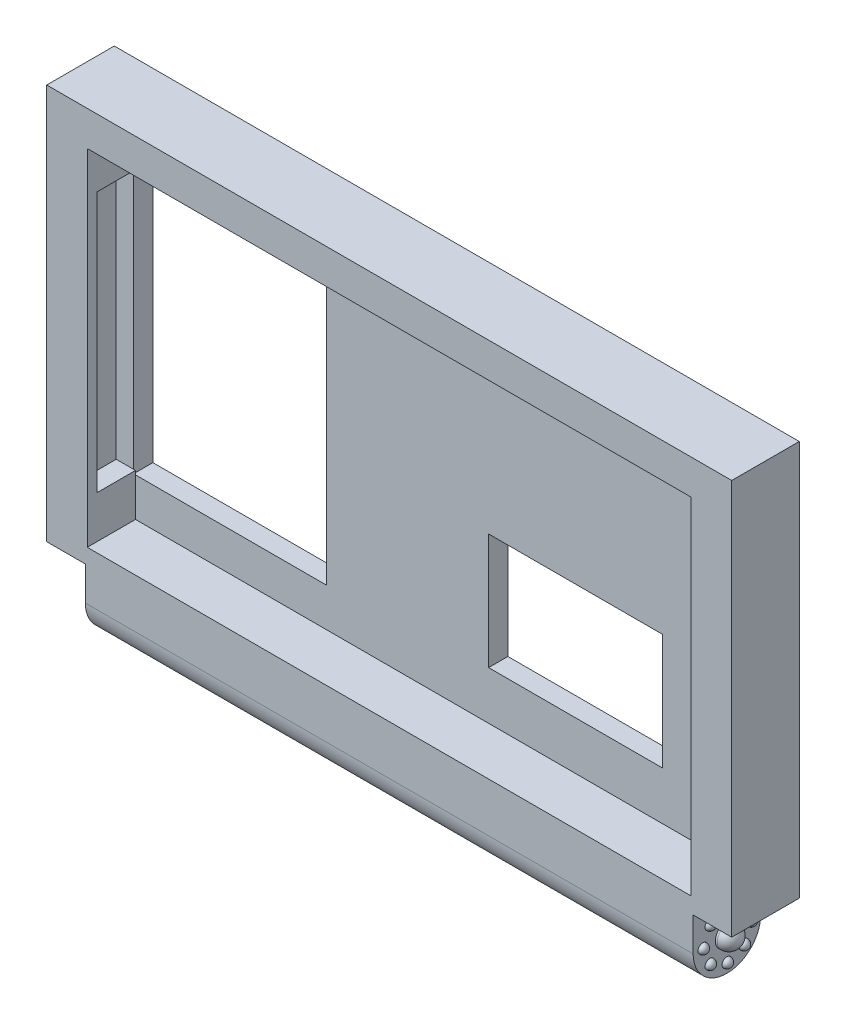
from build123d import *
from build123d.topology import SkipClean

# Parameters (mm, degrees)
SKETCH_1_W               = 35.5
SKETCH_1_H               = 24
EXTRUDE_1_DEPTH          = 3.5
SKETCH_2_W               = 31.3
SKETCH_2_H               = 17.9
CUT_EXTRUDE_1_DEPTH      = 2.5
SKETCH_12_W              = 3.5
SKETCH_12_H              = 3.5
CUT_EXTRUDE_9_DEPTH      = 2
SKETCH_13_W              = 3.5
SKETCH_13_H              = 3.5
CUT_EXTRUDE_10_DEPTH     = 2
SKETCH_14_W              = 10
SKETCH_14_H              = 13.9
CUT_EXTRUDE_11_DEPTH     = 2
SKETCH_18_W              = 2
SKETCH_18_H              = 13.5
CUT_EXTRUDE_12_DEPTH     = 1
SKETCH_19_W              = 9
SKETCH_19_H              = 6
CUT_EXTRUDE_13_DEPTH     = 2
SKETCH_20_R              = 0.6
EXTRUDE_3_DEPTH          = 0.1
EXTRUDE_START            = 0.1
SKETCH_21_R              = 0.6
EXTRUDE_4_DEPTH          = 0.1
FILLET_1_R               = 1.75
FILLET_2_R               = 1.75
PATTERN_CIRCULAR_2_COUNT = 8


with BuildPart() as part:
    # 草图1 → 凸台-拉伸1 (new body)
    with BuildSketch(Plane.XY):
        Rectangle(SKETCH_1_W, SKETCH_1_H)
    extrude(amount=EXTRUDE_1_DEPTH)

    # 草图2 → 切除-拉伸1 (cut)
    with BuildSketch(Plane.XY.offset(3.5)):
        with Locations((0, 1.25)):
            Rectangle(SKETCH_2_W, SKETCH_2_H)
    extrude(amount=-CUT_EXTRUDE_1_DEPTH, mode=Mode.SUBTRACT)

    # 草图12 → 切除-拉伸9 (cut)
    with BuildSketch(Plane.ZY.offset(17.75)):
        with Locations((1.75, -10.25)):
            Rectangle(SKETCH_12_W, SKETCH_12_H)
    extrude(amount=-CUT_EXTRUDE_9_DEPTH, mode=Mode.SUBTRACT)

    # 草图13 → 切除-拉伸10 (cut)
    with BuildSketch(Plane(origin=(17.75, 0, 0), x_dir=(0, 0, -1), z_dir=(1, 0, 0))):
        with Locations((-1.75, -10.25)):
            Rectangle(SKETCH_13_W, SKETCH_13_H)
    extrude(amount=-CUT_EXTRUDE_10_DEPTH, mode=Mode.SUBTRACT)

    # 草图14 → 切除-拉伸11 (cut)
    with BuildSketch(Plane.XY.offset(1)):
        with Locations((-10.75, 1.25)):
            Rectangle(SKETCH_14_W, SKETCH_14_H)
    extrude(amount=-CUT_EXTRUDE_11_DEPTH, mode=Mode.SUBTRACT)

    # 草图18 → 切除-拉伸12 (cut)
    with BuildSketch(Plane(origin=(-15.65, 0, 0), x_dir=(0, 0, -1), z_dir=(1, 0, 0))):
        with Locations((-2, 1.25)):
            Rectangle(SKETCH_18_W, SKETCH_18_H)
    extrude(amount=-CUT_EXTRUDE_12_DEPTH, mode=Mode.SUBTRACT)

    # 草图19 → 切除-拉伸13 (cut)
    with BuildSketch(Plane.XY.offset(1)):
        with Locations((7.15, -2.2)):
            Rectangle(SKETCH_19_W, SKETCH_19_H)
    extrude(amount=-CUT_EXTRUDE_13_DEPTH, mode=Mode.SUBTRACT)

    # 草图20 → 凸台-拉伸3 (add)
    with BuildSketch(Plane.ZY.offset(15.75)):
        with Locations(Location((1.75, -10.25, 0), (0, 0, 180))):
            Circle(SKETCH_20_R)
    extrude(amount=EXTRUDE_3_DEPTH)

    # 草图21 → 凸台-拉伸4 (add)
    with BuildSketch(Plane(origin=(15.75, 0, 0), x_dir=(0, 0, -1), z_dir=(1, 0, 0)).offset(EXTRUDE_START)):
        with Locations((-1.75, -10.25)):
            Circle(SKETCH_21_R)
    extrude(amount=-EXTRUDE_4_DEPTH)

    # 草图23 → 旋转1 (revolve)
    with BuildSketch(Plane.ZY.offset(15.85)):
        with BuildLine():
            Line((1.75, -9.65), (1.75, -10.85))
            ThreePointArc((1.75, -10.85), (2.35, -10.25), (1.75, -9.65))
        make_face()
    revolve(axis=Axis((-15.85, -9.65, 1.75), (0, -1, 0)))

    # 草图24 → 旋转2 (revolve)
    with SkipClean():  # the faces are left unmerged after this step: merging them gives an invalid solid
        with BuildSketch(Plane(origin=(15.85, 0, 0), x_dir=(0, 0, -1), z_dir=(1, 0, 0))):
            with BuildLine():
                ThreePointArc((-2.140499307, -9.794467025), (-2.205532975, -10.640499307), (-1.359500693, -10.705532975))
                Line((-1.359500693, -10.705532975), (-2.140499307, -9.794467025))
            make_face()
            with BuildLine():
                Line((-2.140499307, -9.794467025), (-1.359500693, -10.705532975))
                ThreePointArc((-1.359500693, -10.705532975), (-1.204885524, -10.500699438), (-1.15, -10.25))
                ThreePointArc((-1.15, -10.25), (-1.499300562, -9.704885524), (-2.140499307, -9.794467025))
            make_face()
        revolve(axis=Axis((15.85, -10.705532975, 1.359500693), (0, 0.7592216255630779, 0.65083217750612)))
    add(part.part.scale(1), mode=Mode.REPLACE)  # the faces are merged on a copy

    # 圆角1
    fillet_1_edges = [part.edges().sort_by_distance(p)[0] for p in [
        (0, -12, 3.5),
    ]]
    fillet(fillet_1_edges, radius=FILLET_1_R)

    # 圆角2
    fillet_2_edges = [part.edges().sort_by_distance(p)[0] for p in [
        (0, -12, 0),
    ]]
    fillet(fillet_2_edges, radius=FILLET_2_R - 0.0001)  # a hair under: the kernel refuses the full size

    # 草图25 → 旋转3 (revolve)
    with BuildSketch(Plane(origin=(15.75, 0, 0), x_dir=(0, 0, -1), z_dir=(1, 0, 0))):
        with BuildLine():
            Line((-2, -9), (-1.5, -9))
            ThreePointArc((-1.5, -9), (-1.75, -8.75), (-2, -9))
        make_face()
    revolve_3 = revolve(axis=Axis((15.75, -9, 2), (0, 0, -1)))

    # 阵列(圆周)2: 旋转3 ×8 about axis
    pattern_circular_2_axis = Axis((0, -10.25, 1.75), (1, 0, 0))
    for i in range(1, PATTERN_CIRCULAR_2_COUNT):
        add(revolve_3.rotate(pattern_circular_2_axis, i * 360 / PATTERN_CIRCULAR_2_COUNT))


solid = part.part
